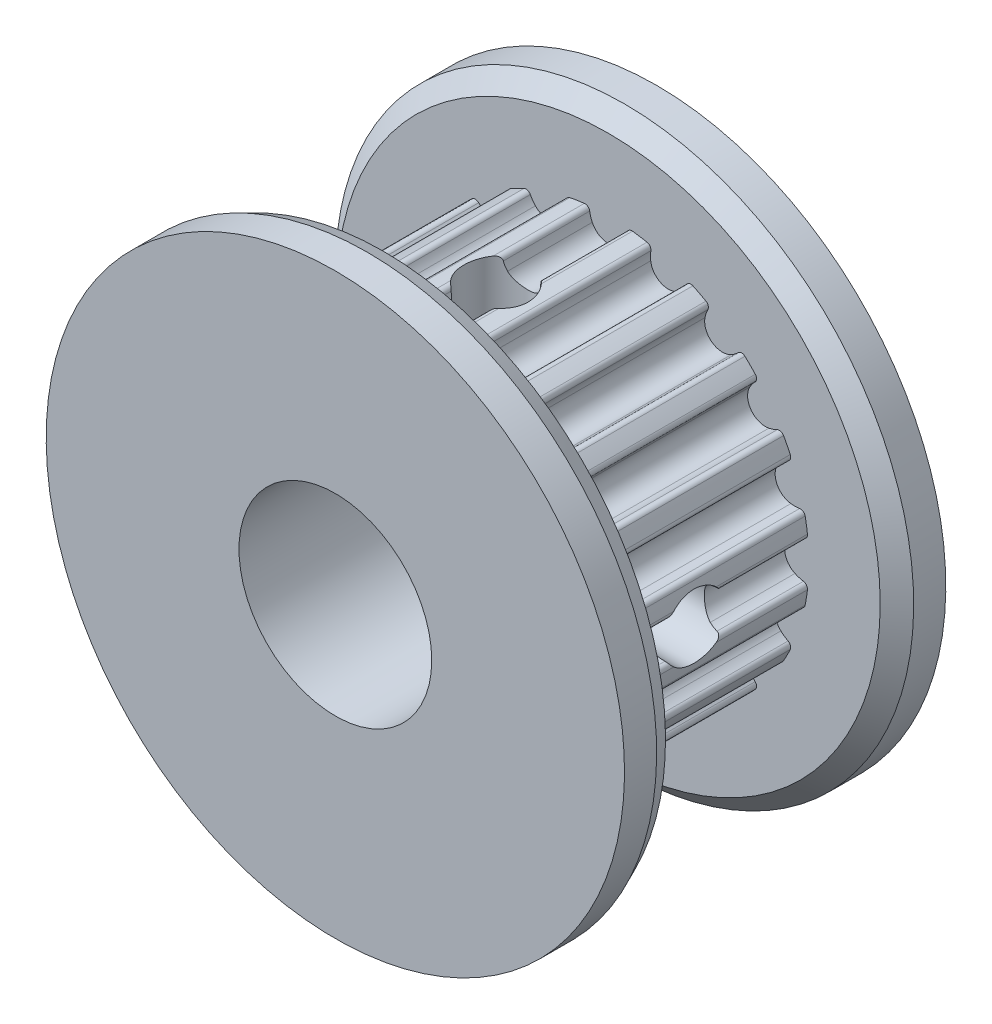
from build123d import *

# Parameters (mm, degrees)
CROQUIS1_R                 = 6.366
SALIENTE_EXTRUIR1_DEPTH    = 7
CORTAR_EXTRUIR1_DEPTH      = 12.404030516
MATRIZC1_COUNT             = 20
CROQUIS6_R                 = 3
CORTAR_EXTRUIR2_DEPTH      = 17.186414056
CORTAR_EXTRUIR3_DEPTH      = 16.305227865
CORTAR_EXTRUIR3_DEPTH_BACK = 16.305227865
CROQUIS7_R                 = 1
CORTAR_EXTRUIR4_DEPTH      = 16.305227921
CORTAR_EXTRUIR4_DEPTH_BACK = 16.305227921
CROQUIS8_R                 = 1


with BuildPart() as part:
    # Croquis1 → Saliente-Extruir1 (new body)
    with BuildSketch(Plane.XY):
        Circle(CROQUIS1_R)
    extrude(amount=SALIENTE_EXTRUIR1_DEPTH)

    # Croquis3 → Cortar-Extruir1 (cut, through all)
    with BuildSketch(Plane(origin=(0, 0, 0), x_dir=(-1, 0, 0), z_dir=(0, 0, -1))):
        with BuildLine():
            ThreePointArc((0.749845546, 6.193775315), (0.863064611, 6.179016142), (0.975994627, 6.162187557))
            Line((0.975994627, 6.162187557), (0.995861804, 6.287623976))
            ThreePointArc((0.995861804, 6.287623976), (0, 6.366), (-0.995861804, 6.287623976))
            Line((-0.995861804, 6.287623976), (-0.975994627, 6.162187557))
            ThreePointArc((-0.975994627, 6.162187557), (-0.863064611, 6.179016142), (-0.749845546, 6.193775315))
            ThreePointArc((-0.749845546, 6.193775315), (-0.641504612, 6.164627299), (-0.583688192, 6.068478318))
            ThreePointArc((-0.583688192, 6.068478318), (-0.55273127, 5.93441999), (-0.503666473, 5.805879678))
            ThreePointArc((-0.503666473, 5.805879678), (0, 5.484), (0.503666473, 5.805879678))
            ThreePointArc((0.503666473, 5.805879678), (0.55273127, 5.93441999), (0.583688192, 6.068478318))
            ThreePointArc((0.583688192, 6.068478318), (0.641504612, 6.164627299), (0.749845546, 6.193775315))
        make_face()
    cortar_extruir1 = extrude(amount=-CORTAR_EXTRUIR1_DEPTH, mode=Mode.SUBTRACT)

    # MatrizC1: Cortar-Extruir1 ×20 about axis
    matrizc1_axis = Axis((0, 0, 7), (0, 0, -1))
    for i in range(1, MATRIZC1_COUNT):
        add(cortar_extruir1.rotate(matrizc1_axis, i * 360 / MATRIZC1_COUNT), mode=Mode.SUBTRACT)

    # Croquis5 → Revolución1 (revolve)
    with BuildSketch(Plane(origin=(0, 0, 0), x_dir=(0, 0, -1), z_dir=(1, 0, 0))):
        Polygon((0, 0), (1.5, 0), (1.5, 9), (0.5, 9), (0, 8.458311378), align=None)
        Polygon((-7, 0), (-8.5, 0), (-8.5, 9), (-7.5, 9), (-7, 8.776025475), align=None)
    revolve(axis=Axis((0, 0, 7), (0, 0, 1)))

    # Croquis6 → Cortar-Extruir2 (cut, through all)
    with BuildSketch(Plane.XY.offset(8.5)):
        Circle(CROQUIS6_R)
    extrude(amount=-CORTAR_EXTRUIR2_DEPTH, mode=Mode.SUBTRACT)

    # Croquis7 → Cortar-Extruir3 (cut, two sides: drawn at the far end of the back side and taken through both)
    with BuildSketch(Plane(origin=(0, 0, 0), x_dir=(0, 0, -1), z_dir=(1, 0, 0)).offset(-CORTAR_EXTRUIR3_DEPTH_BACK)):
        with Locations((-3.5, 0)):
            Circle(CROQUIS7_R)
    extrude(amount=CORTAR_EXTRUIR3_DEPTH + CORTAR_EXTRUIR3_DEPTH_BACK, mode=Mode.SUBTRACT)

    # Croquis8 → Cortar-Extruir4 (cut, two sides: drawn at the far end of the back side and taken through both)
    with BuildSketch(Plane(origin=(0, 0, 0), x_dir=(1, 0, 0), z_dir=(0, 1, 0)).offset(-CORTAR_EXTRUIR4_DEPTH_BACK)):
        with Locations((0, -3.5)):
            Circle(CROQUIS8_R)
    extrude(amount=CORTAR_EXTRUIR4_DEPTH + CORTAR_EXTRUIR4_DEPTH_BACK, mode=Mode.SUBTRACT)


solid = part.part
